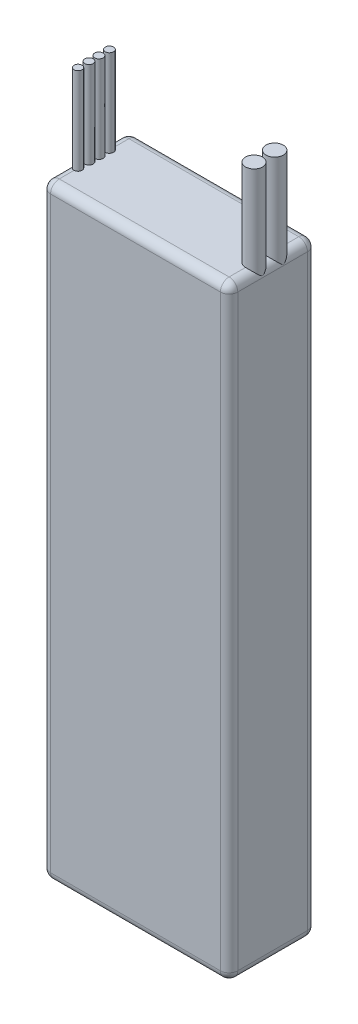
from build123d import *

# Parameters (mm, degrees)
SKETCH1_W                       = 43
SKETCH1_H                       = 20
BOSS_EXTRUDE1_DEPTH             = 139
FILLET1_R                       = 2
SKETCH2_R                       = 1.960015311
SKETCH2_R_2                     = 1.988264752
SKETCH2_R_3                     = 0.918642691
SKETCH2_R_4                     = 0.97117112
SKETCH2_R_5                     = 0.953860003
SKETCH2_R_6                     = 0.951024876
BOSS_EXTRUDE2_DEPTH             = 20
BOSS_EXTRUDE2_DIRECTION_2_REACH = 148.867


with BuildPart() as part:
    # Sketch1 → Boss-Extrude1 (new body)
    with BuildSketch(Plane(origin=(0, 0, 0), x_dir=(1, 0, 0), z_dir=(0, 1, 0))):
        with Locations((21.5, 10)):
            Rectangle(SKETCH1_W, SKETCH1_H)
    extrude(amount=BOSS_EXTRUDE1_DEPTH)

    # Fillet1
    fillet1_edges = [part.edges().sort_by_distance(p)[0] for p in [
        (21.5, 0, -20),
        (0, 69.5, -20),
        (0, 0, -10),
        (21.5, 139, -20),
        (0, 139, -10),
        (43, 139, -10),
        (43, 69.5, -20),
        (43, 0, -10),
        (0, 69.5, 0),
        (21.5, 139, 0),
        (43, 69.5, 0),
        (21.5, 0, 0),
    ]]
    fillet(fillet1_edges, radius=FILLET1_R)

    # Sketch2 → Boss-Extrude2 (add)
    with BuildSketch(Plane(origin=(0, 139, 0), x_dir=(1, 0, 0), z_dir=(0, 1, 0))):
        with Locations((41, 7.731273805)):
            Circle(SKETCH2_R)
        with Locations((41, 12.467660333)):
            Circle(SKETCH2_R_2)
        with Locations((2, 6.327900019)):
            Circle(SKETCH2_R_3)
        with Locations((2, 11.108141978)):
            Circle(SKETCH2_R_4)
        with Locations((2, 13.520190672)):
            Circle(SKETCH2_R_5)
        with Locations((2, 8.827659575)):
            Circle(SKETCH2_R_6)
    extrude(amount=BOSS_EXTRUDE2_DEPTH)

    # Sketch2 → Boss-Extrude2 direction 2 (add, up to next)
    with BuildSketch(Plane(origin=(0, 139, 0), x_dir=(1, 0, 0), z_dir=(0, 1, 0)), mode=Mode.PRIVATE) as boss_extrude2_direction_2_sk1:
        with Locations((41, 7.731273805)):
            Circle(SKETCH2_R)
    boss_extrude2_direction_2_tool1 = extrude(boss_extrude2_direction_2_sk1.sketch, amount=-BOSS_EXTRUDE2_DIRECTION_2_REACH, mode=Mode.PRIVATE) - part.part
    # Sketch2 → Boss-Extrude2 direction 2 (add, up to next)
    with BuildSketch(Plane(origin=(0, 139, 0), x_dir=(1, 0, 0), z_dir=(0, 1, 0)), mode=Mode.PRIVATE) as boss_extrude2_direction_2_sk2:
        with Locations((41, 12.467660333)):
            Circle(SKETCH2_R_2)
    boss_extrude2_direction_2_tool2 = extrude(boss_extrude2_direction_2_sk2.sketch, amount=-BOSS_EXTRUDE2_DIRECTION_2_REACH, mode=Mode.PRIVATE) - part.part
    # Sketch2 → Boss-Extrude2 direction 2 (add, up to next)
    with BuildSketch(Plane(origin=(0, 139, 0), x_dir=(1, 0, 0), z_dir=(0, 1, 0)), mode=Mode.PRIVATE) as boss_extrude2_direction_2_sk3:
        with Locations((2, 6.327900019)):
            Circle(SKETCH2_R_3)
    boss_extrude2_direction_2_tool3 = extrude(boss_extrude2_direction_2_sk3.sketch, amount=-BOSS_EXTRUDE2_DIRECTION_2_REACH, mode=Mode.PRIVATE) - part.part
    # Sketch2 → Boss-Extrude2 direction 2 (add, up to next)
    with BuildSketch(Plane(origin=(0, 139, 0), x_dir=(1, 0, 0), z_dir=(0, 1, 0)), mode=Mode.PRIVATE) as boss_extrude2_direction_2_sk4:
        with Locations((2, 11.108141978)):
            Circle(SKETCH2_R_4)
    boss_extrude2_direction_2_tool4 = extrude(boss_extrude2_direction_2_sk4.sketch, amount=-BOSS_EXTRUDE2_DIRECTION_2_REACH, mode=Mode.PRIVATE) - part.part
    # Sketch2 → Boss-Extrude2 direction 2 (add, up to next)
    with BuildSketch(Plane(origin=(0, 139, 0), x_dir=(1, 0, 0), z_dir=(0, 1, 0)), mode=Mode.PRIVATE) as boss_extrude2_direction_2_sk5:
        with Locations((2, 13.520190672)):
            Circle(SKETCH2_R_5)
    boss_extrude2_direction_2_tool5 = extrude(boss_extrude2_direction_2_sk5.sketch, amount=-BOSS_EXTRUDE2_DIRECTION_2_REACH, mode=Mode.PRIVATE) - part.part
    # Sketch2 → Boss-Extrude2 direction 2 (add, up to next)
    with BuildSketch(Plane(origin=(0, 139, 0), x_dir=(1, 0, 0), z_dir=(0, 1, 0)), mode=Mode.PRIVATE) as boss_extrude2_direction_2_sk6:
        with Locations((2, 8.827659575)):
            Circle(SKETCH2_R_6)
    boss_extrude2_direction_2_tool6 = extrude(boss_extrude2_direction_2_sk6.sketch, amount=-BOSS_EXTRUDE2_DIRECTION_2_REACH, mode=Mode.PRIVATE) - part.part
    add(boss_extrude2_direction_2_tool1.solids().sort_by_distance((41, 139, -7.731274))[0])
    add(boss_extrude2_direction_2_tool2.solids().sort_by_distance((41, 139, -12.46766))[0])
    add(boss_extrude2_direction_2_tool3.solids().sort_by_distance((2, 139, -6.3279))[0])
    add(boss_extrude2_direction_2_tool4.solids().sort_by_distance((2, 139, -11.108142))[0])
    add(boss_extrude2_direction_2_tool5.solids().sort_by_distance((2, 139, -13.520191))[0])
    add(boss_extrude2_direction_2_tool6.solids().sort_by_distance((2, 139, -8.82766))[0])


solid = part.part
